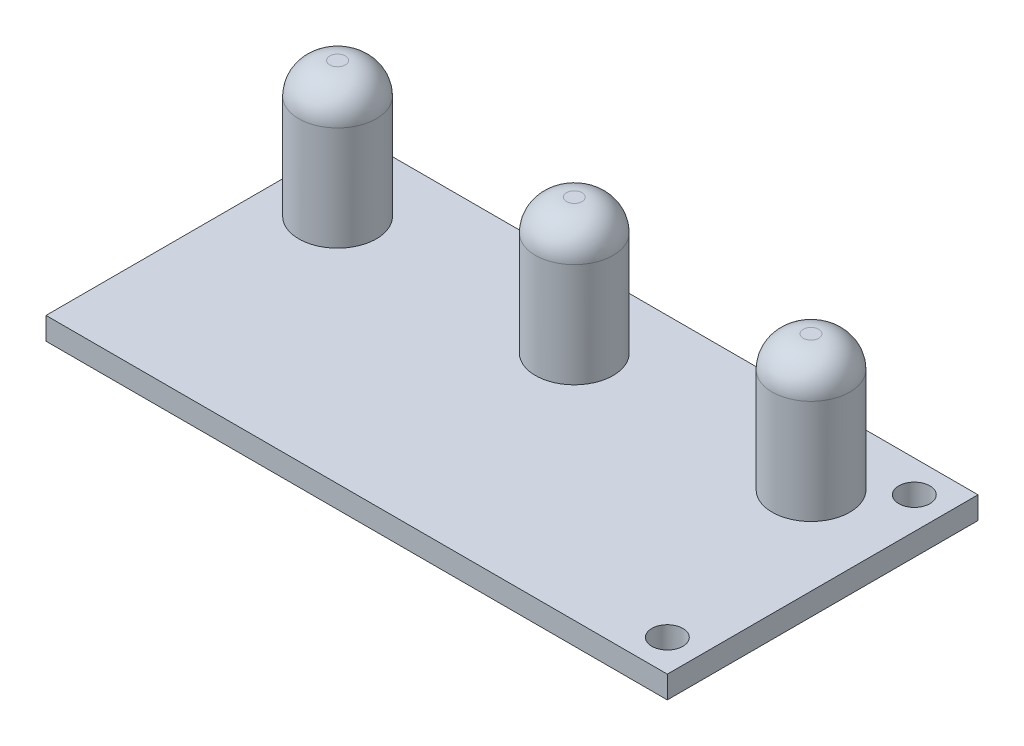
from build123d import *

# Parameters (mm, degrees)
SKETCH1_W           = 40
SKETCH1_H           = 20
BOSS_EXTRUDE1_DEPTH = 1.44
SKETCH2_R           = 2.5
BOSS_EXTRUDE2_DEPTH = 8.7
FILLET1_R           = 2
SKETCH3_R           = 1
CUT_EXTRUDE1_DEPTH  = 24.993540797


with BuildPart() as part:
    # Sketch1 → Boss-Extrude1 (new body)
    with BuildSketch(Plane(origin=(0, 0, 0), x_dir=(1, 0, 0), z_dir=(0, 1, 0))):
        Rectangle(SKETCH1_W, SKETCH1_H)
    extrude(amount=BOSS_EXTRUDE1_DEPTH)

    # Sketch2 → Boss-Extrude2 (add)
    with BuildSketch(Plane(origin=(0, 1.44, 0), x_dir=(1, 0, 0), z_dir=(0, 1, 0))):
        with Locations((14.35, 4.9)):
            Circle(SKETCH2_R)
        with Locations((-0.89, 4.9)):
            Circle(SKETCH2_R)
        with Locations((-16.13, 4.9)):
            Circle(SKETCH2_R)
    extrude(amount=BOSS_EXTRUDE2_DEPTH)

    # Fillet1
    fillet1_edges = [part.edges().sort_by_distance(p)[0] for p in [
        (11.85, 10.14, -4.9),
        (-3.39, 10.14, -4.9),
        (-18.63, 10.14, -4.9),
    ]]
    fillet(fillet1_edges, radius=FILLET1_R)

    # Sketch3 → Cut-Extrude1 (cut, through all)
    with BuildSketch(Plane(origin=(0, 1.44, 0), x_dir=(1, 0, 0), z_dir=(0, 1, 0))):
        with Locations((17.95, 7.95)):
            Circle(SKETCH3_R)
        with Locations((17.95, -7.95)):
            Circle(SKETCH3_R)
    extrude(amount=-CUT_EXTRUDE1_DEPTH, mode=Mode.SUBTRACT)


solid = part.part
